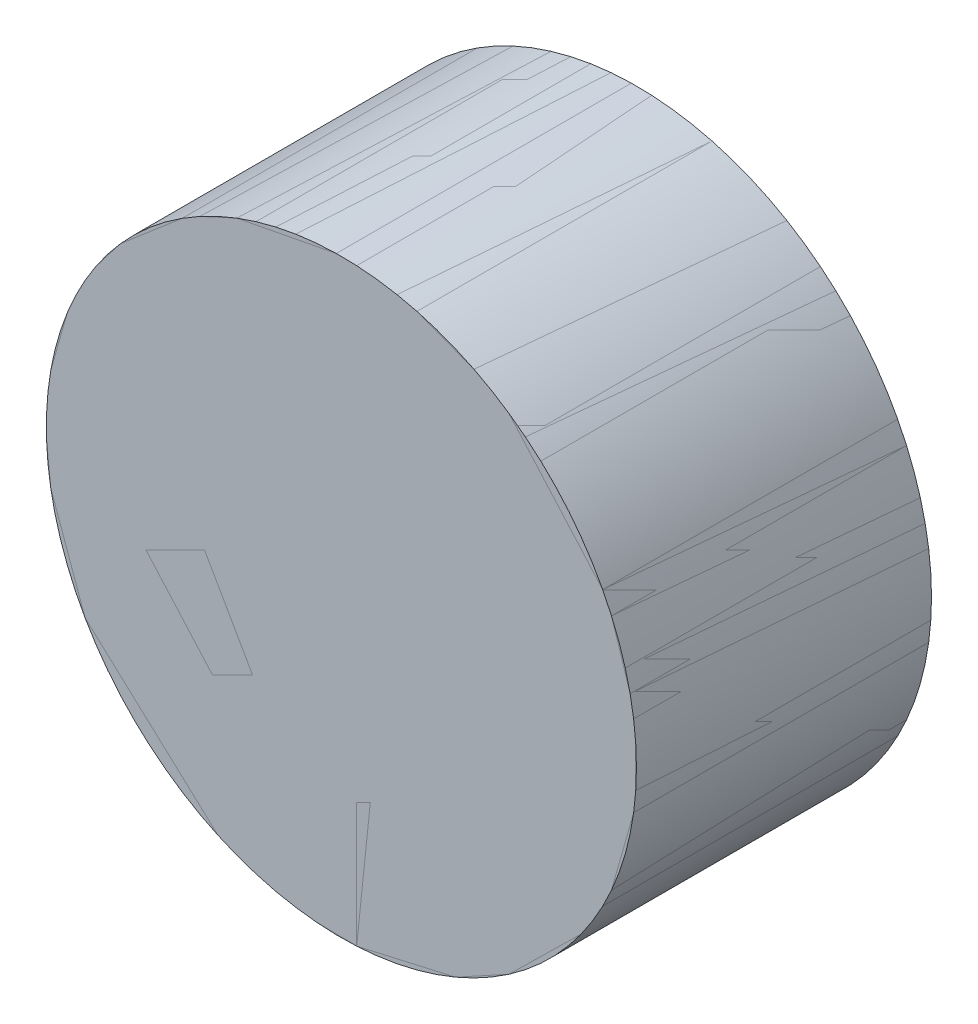
from build123d import *

# Parameters (mm, degrees)
SKETCH1_R                 = 10
BOSS_EXTRUDE1_DEPTH       = 5
BODY_MOVE_COPY1_START     = -5
BODY_MOVE_COPY1_OUTLINE_R = 10
BODY_MOVE_COPY1_DEPTH     = 10


# Read off the part's stored shape, not the designer's step: Body-Move/Copy1
with BuildPart() as part:
    # Sketch1 → Boss-Extrude1 (new, symmetric)
    with BuildSketch(Plane.XY):
        Circle(SKETCH1_R)
    extrude(amount=BOSS_EXTRUDE1_DEPTH, both=True)


with BuildPart() as body_2:
    # Body-Move/Copy1 outline → Body-Move/Copy1 (new body)
    with BuildSketch(Plane.XY.offset(BODY_MOVE_COPY1_START)):
        Circle(BODY_MOVE_COPY1_OUTLINE_R)
    extrude(amount=BODY_MOVE_COPY1_DEPTH)


solid = Compound([part.part, body_2.part])
